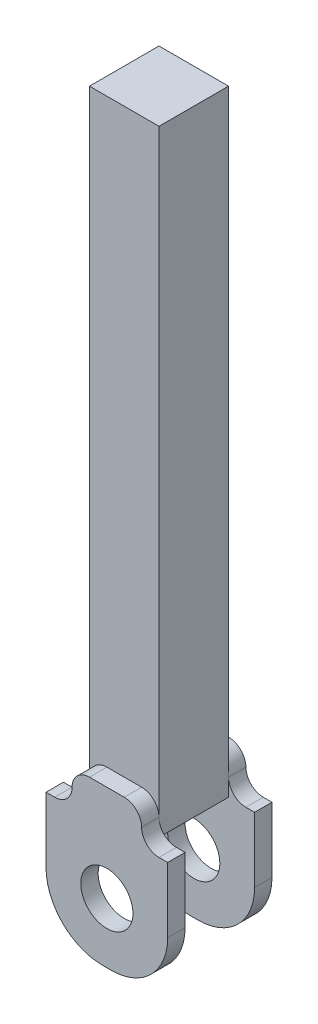
from build123d import *

# Parameters (mm, degrees)
SKETCH1_W           = 50.8
SKETCH1_H           = 50.8
BOSS_EXTRUDE1_DEPTH = 450
SKETCH3_R           = 19.05
BOSS_EXTRUDE2_DEPTH = 12.7
FILLET1_R           = 12.7
FILLET3_R           = 41.275


with BuildPart() as part:
    # Sketch1 → Boss-Extrude1 (new body)
    with BuildSketch(Plane(origin=(0, 0, 0), x_dir=(1, 0, 0), z_dir=(0, 1, 0))):
        Rectangle(SKETCH1_W, SKETCH1_H)
    extrude(amount=BOSS_EXTRUDE1_DEPTH)

    # Sketch3 → Boss-Extrude2 (add)
    with BuildSketch(Plane.XY.offset(25.4)):
        Polygon((-25.4, 0), (-25.4, 25.4), (25.4, 25.4), (25.4, 0), (44.45, 0), (44.45, -88.9), (-44.45, -88.9), (-44.45, 0), align=None)
        with Locations((0, -45)):
            Circle(SKETCH3_R, mode=Mode.SUBTRACT)
    boss_extrude2 = extrude(amount=BOSS_EXTRUDE2_DEPTH)

    # Mirror1: Boss-Extrude2 across plane
    add(boss_extrude2.mirror(Plane.XY))

    # Fillet1
    fillet1_edges = [part.edges().sort_by_distance(p)[0] for p in [
        (25.4, 0, 31.75),
        (25.4, 0, -31.75),
        (-25.4, 0, -31.75),
        (-25.4, 0, 31.75),
    ]]
    fillet(fillet1_edges, radius=FILLET1_R)
    fillet1_2_edges = [part.edges().sort_by_distance(p)[0] for p in [
        (25.4, 25.4, -31.75),
        (-25.4, 25.4, -31.75),
        (25.4, 25.4, 31.75),
        (-25.4, 25.4, 31.75),
    ]]
    fillet(fillet1_2_edges, radius=FILLET1_R - 0.0001)  # a hair under: the kernel refuses the full size

    # Fillet3
    fillet3_edges = [part.edges().sort_by_distance(p)[0] for p in [
        (-44.45, -88.9, 31.75),
        (44.45, -88.9, 31.75),
        (-44.45, -88.9, -31.75),
        (44.45, -88.9, -31.75),
    ]]
    fillet(fillet3_edges, radius=FILLET3_R)


solid = part.part
